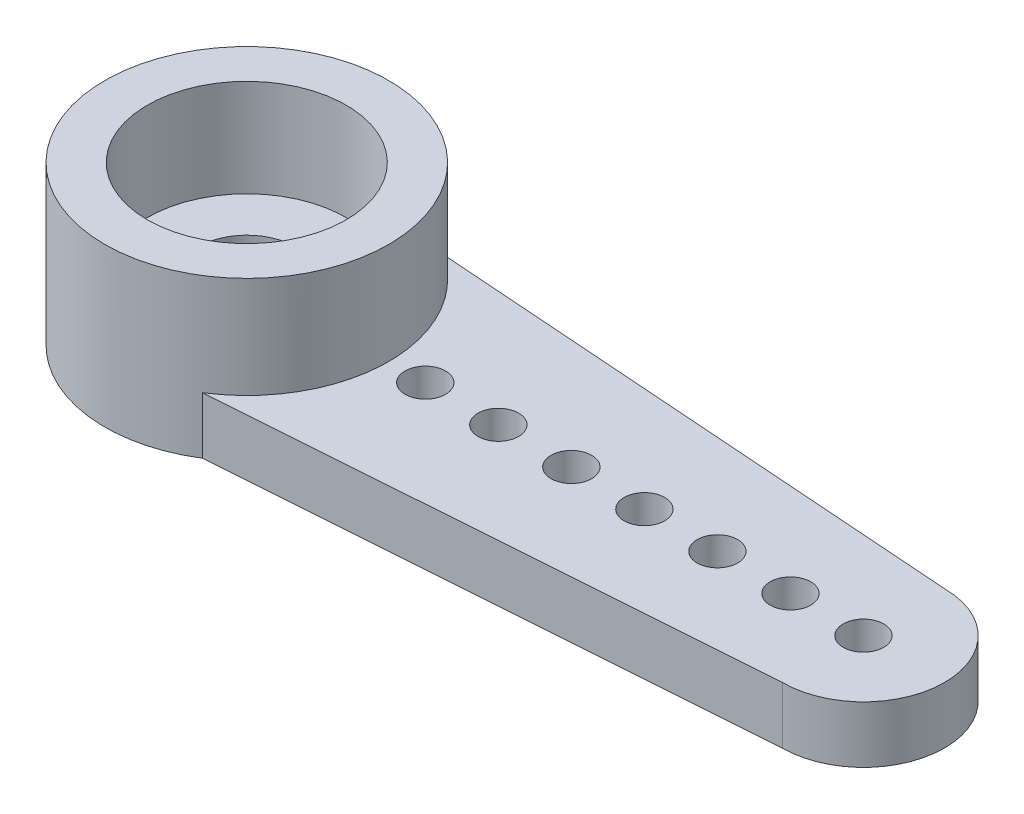
from build123d import *

# Parameters (mm, degrees)
SKETCH1_R           = 0.5
BOSS_EXTRUDE1_DEPTH = 1.4
SKETCH2_R           = 2.35
CUT_EXTRUDE1_DEPTH  = 1
SKETCH3_R           = 3.5
SKETCH3_R_2         = 2.45
BOSS_EXTRUDE2_DEPTH = 2.5
SKETCH4_R           = 1.2
CUT_EXTRUDE2_DEPTH  = 20.282440198
SKETCH5_R           = 2.45
SKETCH5_R_2         = 1.2
BOSS_EXTRUDE3_DEPTH = 0.1
SKETCH6_W           = 35.735260114
SKETCH6_H           = 17.672039004
CUT_EXTRUDE4_DEPTH  = 20.513392837
CUT_EXTRUDE5_DEPTH  = 18.980545042


with BuildPart() as part:
    # Sketch1 → Boss-Extrude1 (new body)
    with BuildSketch(Plane(origin=(0, 0, 0), x_dir=(1, 0, 0), z_dir=(0, 1, 0))):
        with BuildLine():
            Line((-15.2, 2), (-2, 2.95))
            Line((-2, 2.95), (-2, 6.35))
            ThreePointArc((-2, 6.35), (0, 8.35), (2, 6.35))
            Line((2, 6.35), (2, 3.5))
            Line((2, 3.5), (15.2, 2))
            ThreePointArc((15.2, 2), (17.2, 0), (15.2, -2))
            Line((15.2, -2), (2, -3.5))
            Line((2, -3.5), (2, -6.35))
            ThreePointArc((2, -6.35), (0, -8.35), (-2, -6.35))
            Line((-2, -6.35), (-2, -2.95))
            Line((-2, -2.95), (-15.2, -2))
            ThreePointArc((-15.2, -2), (-17.2, 0), (-15.2, 2))
        make_face()
        with Locations((0, 6.35)):
            Circle(SKETCH1_R, mode=Mode.SUBTRACT)
        with Locations((0, 4.55)):
            Circle(SKETCH1_R, mode=Mode.SUBTRACT)
        with Locations((0, -4.55)):
            Circle(SKETCH1_R, mode=Mode.SUBTRACT)
        with Locations((0, -6.35)):
            Circle(SKETCH1_R, mode=Mode.SUBTRACT)
        with Locations((-15.2, 0)):
            Circle(SKETCH1_R, mode=Mode.SUBTRACT)
        with Locations((15.2, 0)):
            Circle(SKETCH1_R, mode=Mode.SUBTRACT)
        with Locations((-13.4, 0)):
            Circle(SKETCH1_R, mode=Mode.SUBTRACT)
        with Locations((-11.6, 0)):
            Circle(SKETCH1_R, mode=Mode.SUBTRACT)
        with Locations((-9.8, 0)):
            Circle(SKETCH1_R, mode=Mode.SUBTRACT)
        with Locations((-8, 0)):
            Circle(SKETCH1_R, mode=Mode.SUBTRACT)
        with Locations((-6.2, 0)):
            Circle(SKETCH1_R, mode=Mode.SUBTRACT)
        with Locations((-4.4, 0)):
            Circle(SKETCH1_R, mode=Mode.SUBTRACT)
        with Locations((13.4, 0)):
            Circle(SKETCH1_R, mode=Mode.SUBTRACT)
        with Locations((11.6, 0)):
            Circle(SKETCH1_R, mode=Mode.SUBTRACT)
        with Locations((9.8, 0)):
            Circle(SKETCH1_R, mode=Mode.SUBTRACT)
        with Locations((8, 0)):
            Circle(SKETCH1_R, mode=Mode.SUBTRACT)
        with Locations((6.2, 0)):
            Circle(SKETCH1_R, mode=Mode.SUBTRACT)
        with Locations((4.4, 0)):
            Circle(SKETCH1_R, mode=Mode.SUBTRACT)
    extrude(amount=BOSS_EXTRUDE1_DEPTH)

    # Sketch2 → Cut-Extrude1 (cut)
    with BuildSketch(Plane.XZ):
        Circle(SKETCH2_R)
    extrude(amount=-CUT_EXTRUDE1_DEPTH, mode=Mode.SUBTRACT)

    # Sketch3 → Boss-Extrude2 (add)
    with BuildSketch(Plane(origin=(0, 1.4, 0), x_dir=(1, 0, 0), z_dir=(0, 1, 0))):
        Circle(SKETCH3_R)
        Circle(SKETCH3_R_2, mode=Mode.SUBTRACT)
    extrude(amount=BOSS_EXTRUDE2_DEPTH)

    # Sketch4 → Cut-Extrude2 (cut, through all)
    with BuildSketch(Plane(origin=(0, 1.4, 0), x_dir=(1, 0, 0), z_dir=(0, 1, 0))):
        Circle(SKETCH4_R)
    extrude(amount=-CUT_EXTRUDE2_DEPTH, mode=Mode.SUBTRACT)

    # Sketch5 → Boss-Extrude3 (add)
    with BuildSketch(Plane(origin=(0, 1.4, 0), x_dir=(1, 0, 0), z_dir=(0, 1, 0))):
        Circle(SKETCH5_R)
        Circle(SKETCH5_R_2, mode=Mode.SUBTRACT)
    extrude(amount=BOSS_EXTRUDE3_DEPTH)

    # Sketch6 → Cut-Extrude4 (cut, through all)
    with BuildSketch(Plane.XZ):
        Rectangle(SKETCH6_W, SKETCH6_H)
        with BuildLine():
            Line((-1.868584713, -2.959457918), (-15.2, -2))
            ThreePointArc((-15.2, -2), (-17.2, 0), (-15.2, 2))
            Line((-15.2, 2), (-1.868584713, 2.959457918))
            ThreePointArc((-1.868584713, 2.959457918), (0, 3.5), (1.868584713, 2.959457918))
            Line((1.868584713, 2.959457918), (15.2, 2))
            ThreePointArc((15.2, 2), (17.2, 0), (15.2, -2))
            Line((15.2, -2), (1.868584713, -2.959457918))
            ThreePointArc((1.868584713, -2.959457918), (0, -3.5), (-1.868584713, -2.959457918))
        make_face(mode=Mode.SUBTRACT)
    extrude(amount=-CUT_EXTRUDE4_DEPTH, mode=Mode.SUBTRACT)

    # Sketch7 → Cut-Extrude5 (cut, through all)
    with BuildSketch(Plane.XZ):
        with BuildLine():
            Line((0, 3.5), (-17.731768104, 3.5))
            Line((-17.731768104, 3.5), (-17.731768104, -3.5))
            Line((-17.731768104, -3.5), (0, -3.5))
            ThreePointArc((0, -3.5), (-3.5, 0), (0, 3.5))
        make_face()
    extrude(amount=-CUT_EXTRUDE5_DEPTH, mode=Mode.SUBTRACT)


solid = part.part
